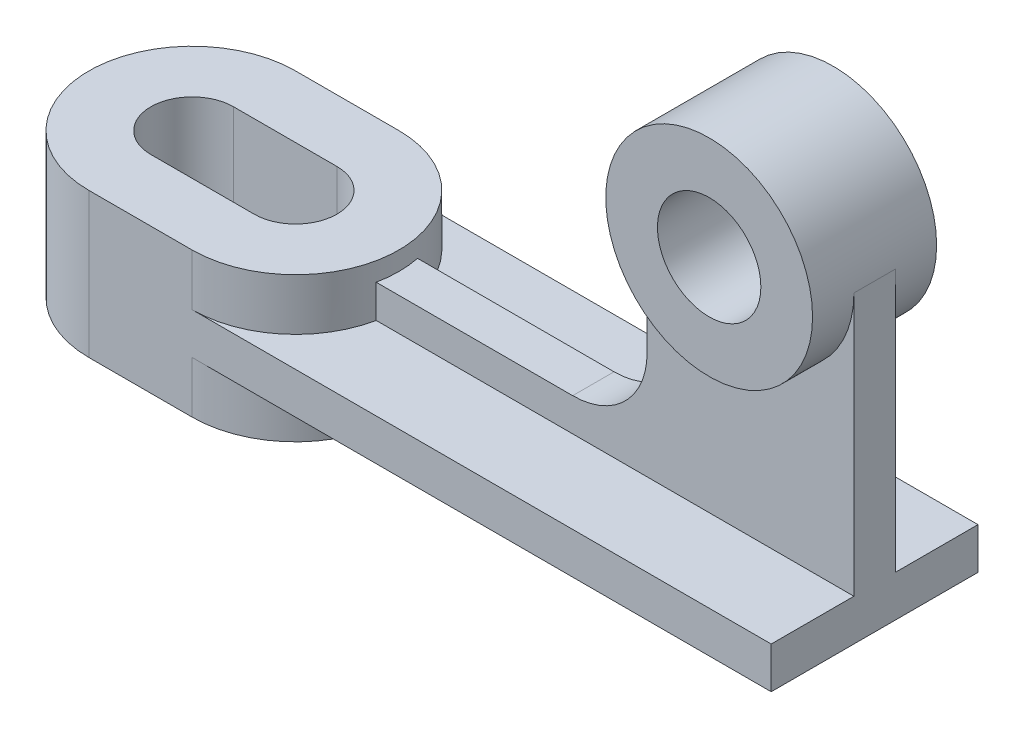
from build123d import *

# Parameters (mm, degrees)
BOSS_EXTRUDE10_DEPTH       = 22.5
BOSS_EXTRUDE10_DEPTH_BACK  = 12.5
BOSS_EXTRUDE11_DEPTH       = 10
BOSS_EXTRUDE12_DEPTH       = 18
BOSS_EXTRUDE13_DEPTH       = 5
BOSS_EXTRUDE13_DEPTH_BACK  = 5
BOSS_EXTRUDE14_START       = -15
BOSS_EXTRUDE14_OUTLINE_R   = 25
BOSS_EXTRUDE14_OUTLINE_R_2 = 12.5
BOSS_EXTRUDE14_DEPTH       = 30


# Read off the part's stored shape, not the designer's step: Boss-Extrude14
with BuildPart() as part:
    # Sketch1 → Boss-Extrude10 (new, two sides: drawn at the far end of the back side and taken through both)
    with BuildSketch(Plane(origin=(0, 0, 0), x_dir=(1, 0, 0), z_dir=(0, 1, 0)).offset(-BOSS_EXTRUDE10_DEPTH_BACK)):
        with BuildLine():
            Line((-70.624644485, -25), (-45.624644485, -25))
            ThreePointArc((-45.624644485, -25), (-20.624644485, 0), (-45.624644485, 25))
            Line((-45.624644485, 25), (-70.624644485, 25))
            ThreePointArc((-70.624644485, 25), (-95.624644485, 0), (-70.624644485, -25))
        make_face()
        with BuildLine():
            ThreePointArc((-45.624644485, -10), (-35.624644485, 0), (-45.624644485, 10))
            Line((-45.624644485, 10), (-70.624644485, 10))
            ThreePointArc((-70.624644485, 10), (-80.624644485, 0), (-70.624644485, -10))
            Line((-70.624644485, -10), (-45.624644485, -10))
        make_face(mode=Mode.SUBTRACT)
    extrude(amount=BOSS_EXTRUDE10_DEPTH + BOSS_EXTRUDE10_DEPTH_BACK)

    # Sketch1<6> → Boss-Extrude11 (add)
    with BuildSketch(Plane(origin=(0, 0, 0), x_dir=(1, 0, 0), z_dir=(0, 1, 0))):
        with BuildLine():
            ThreePointArc((-21.129747057, -5), (-29.813256184, -19.364916731), (-45.624644485, -25))
            Line((-45.624644485, -25), (94.375355515, -25))
            Line((94.375355515, -25), (94.375355515, -5))
            Line((94.375355515, -5), (-21.129747057, -5))
        make_face()
        with BuildLine():
            Line((94.375355515, 25), (-45.624644485, 25))
            ThreePointArc((-45.624644485, 25), (-29.813256184, 19.364916731), (-21.129747057, 5))
            Line((-21.129747057, 5), (94.375355515, 5))
            Line((94.375355515, 5), (94.375355515, 25))
        make_face()
    extrude(amount=BOSS_EXTRUDE11_DEPTH)

    # Sketch1<7> → Boss-Extrude12 (add)
    with BuildSketch(Plane(origin=(0, 0, 0), x_dir=(1, 0, 0), z_dir=(0, 1, 0))):
        with BuildLine():
            Line((94.375355515, 5), (-21.129747057, 5))
            ThreePointArc((-21.129747057, 5), (-20.624644485, 0), (-21.129747057, -5))
            Line((-21.129747057, -5), (94.375355515, -5))
            Line((94.375355515, -5), (94.375355515, 5))
        make_face()
    extrude(amount=BOSS_EXTRUDE12_DEPTH)

    # Sketch2 → Boss-Extrude13 (add, two sides: drawn at the far end of the back side and taken through both)
    with BuildSketch(Plane.XY.offset(-BOSS_EXTRUDE13_DEPTH_BACK)):
        with BuildLine():
            ThreePointArc((44.375355515, 36), (39.103277576, 23.272077939), (26.375355515, 18))
            Line((26.375355515, 18), (94.375355515, 18))
            Line((94.375355515, 18), (94.375355515, 73.5))
            ThreePointArc((94.375355515, 73.5), (69.375355515, 48.5), (44.375355515, 73.5))
            Line((44.375355515, 73.5), (44.375355515, 36))
        make_face()
    extrude(amount=BOSS_EXTRUDE13_DEPTH + BOSS_EXTRUDE13_DEPTH_BACK)

    # Boss-Extrude14 outline → Boss-Extrude14 (add)
    with BuildSketch(Plane.XY.offset(BOSS_EXTRUDE14_START)):
        with Locations((69.375355515, 73.5)):
            Circle(BOSS_EXTRUDE14_OUTLINE_R)
        with Locations((69.375355515, 73.5)):
            Circle(BOSS_EXTRUDE14_OUTLINE_R_2, mode=Mode.SUBTRACT)
    extrude(amount=BOSS_EXTRUDE14_DEPTH)


solid = part.part
